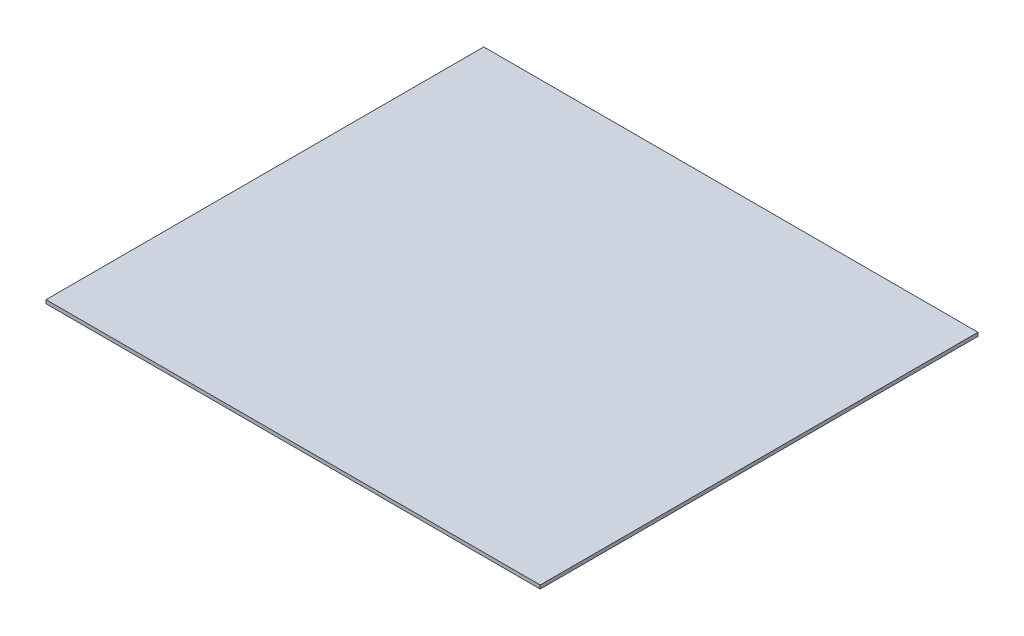
from build123d import *

# Parameters (mm, degrees)
SKETCH1_W           = 444.5
SKETCH1_H           = 393.7
BOSS_EXTRUDE1_DEPTH = 3.175


with BuildPart() as part:
    # Sketch1 → Boss-Extrude1 (new body)
    with BuildSketch(Plane(origin=(0, 0, 0), x_dir=(1, 0, 0), z_dir=(0, 1, 0))):
        Rectangle(SKETCH1_W, SKETCH1_H)
    extrude(amount=BOSS_EXTRUDE1_DEPTH)


solid = part.part
